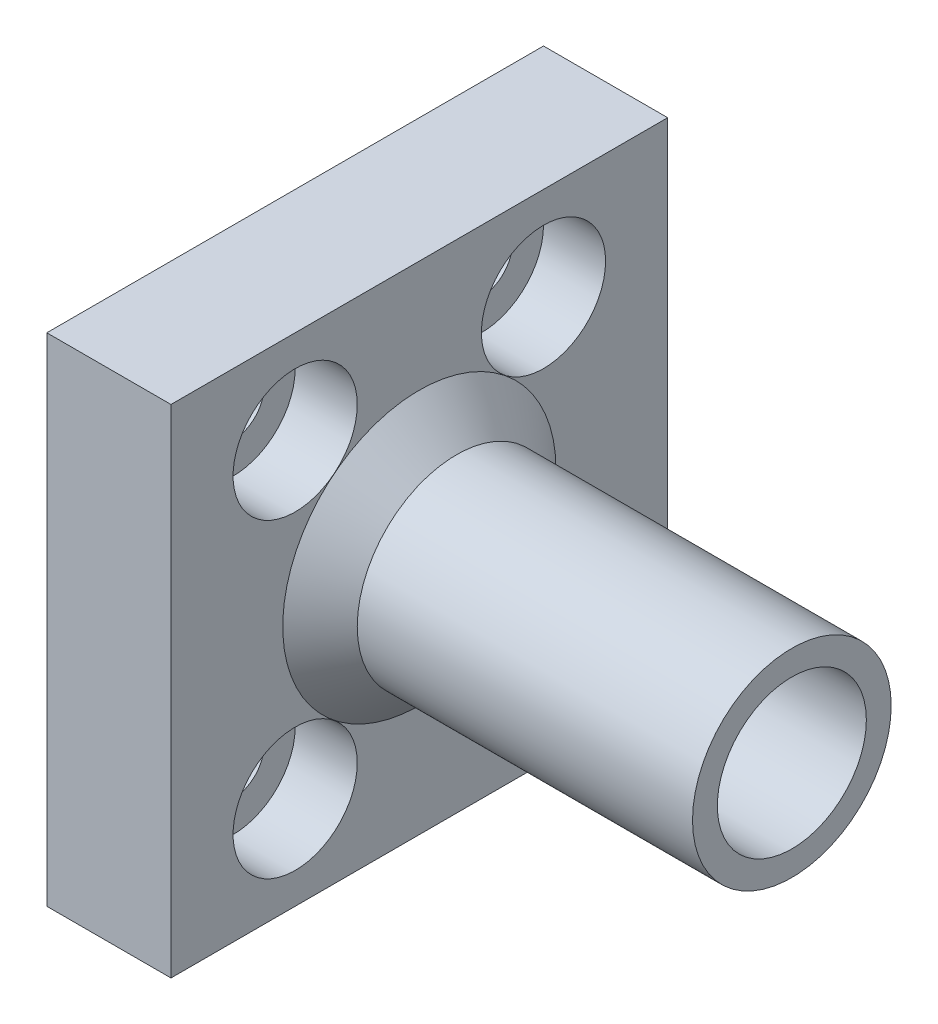
from build123d import *

# Parameters (mm, degrees)
SKETCH1_W           = 40
SKETCH1_H           = 40
BOSS_EXTRUDE1_DEPTH = 10
SKETCH2_R           = 8
BOSS_EXTRUDE2_DEPTH = 30
SKETCH4_R           = 2.5
CUT_EXTRUDE1_DEPTH  = 42.231056256
SKETCH5_R           = 6
CUT_EXTRUDE2_DEPTH  = 34
SKETCH6_R           = 5
CUT_EXTRUDE3_DEPTH  = 5
SKETCH7_R           = 1
CUT_EXTRUDE4_DEPTH  = 45.226688775
SKETCH8_R           = 2.5
CUT_EXTRUDE5_DEPTH  = 3
CHAMFER1_SIZE       = 3


with BuildPart() as part:
    # Sketch1 → Boss-Extrude1 (new body)
    with BuildSketch(Plane(origin=(0, 0, 0), x_dir=(0, 0, -1), z_dir=(1, 0, 0))):
        Rectangle(SKETCH1_W, SKETCH1_H)
    extrude(amount=BOSS_EXTRUDE1_DEPTH)

    # Sketch2 → Boss-Extrude2 (add)
    with BuildSketch(Plane(origin=(10, 0, 0), x_dir=(0, 0, -1), z_dir=(1, 0, 0))):
        Circle(SKETCH2_R)
    extrude(amount=BOSS_EXTRUDE2_DEPTH)

    # Sketch4 → Cut-Extrude1 (cut, through all)
    with BuildSketch(Plane(origin=(10, 0, 0), x_dir=(0, 0, -1), z_dir=(1, 0, 0))):
        with Locations((-10, 12.5)):
            Circle(SKETCH4_R)
        with Locations((-10, -12.5)):
            Circle(SKETCH4_R)
        with Locations((10, 12.5)):
            Circle(SKETCH4_R)
        with Locations((10, -12.5)):
            Circle(SKETCH4_R)
    extrude(amount=-CUT_EXTRUDE1_DEPTH, mode=Mode.SUBTRACT)

    # Sketch5 → Cut-Extrude2 (cut)
    with BuildSketch(Plane(origin=(40, 0, 0), x_dir=(0, 0, -1), z_dir=(1, 0, 0))):
        Circle(SKETCH5_R)
    extrude(amount=-CUT_EXTRUDE2_DEPTH, mode=Mode.SUBTRACT)

    # Sketch6 → Cut-Extrude3 (cut)
    with BuildSketch(Plane(origin=(10, 0, 0), x_dir=(0, 0, -1), z_dir=(1, 0, 0))):
        with Locations((-10, 12.5)):
            Circle(SKETCH6_R)
        with Locations((10, 12.5)):
            Circle(SKETCH6_R)
        with Locations((10, -12.5)):
            Circle(SKETCH6_R)
        with Locations((-10, -12.5)):
            Circle(SKETCH6_R)
    extrude(amount=-CUT_EXTRUDE3_DEPTH, mode=Mode.SUBTRACT)

    # Sketch7 → Cut-Extrude4 (cut, through all)
    with BuildSketch(Plane(origin=(6, 0, 0), x_dir=(0, 0, -1), z_dir=(1, 0, 0))):
        Circle(SKETCH7_R)
    extrude(amount=-CUT_EXTRUDE4_DEPTH, mode=Mode.SUBTRACT)

    # Sketch8 → Cut-Extrude5 (cut)
    with BuildSketch(Plane.ZY):
        Circle(SKETCH8_R)
    extrude(amount=-CUT_EXTRUDE5_DEPTH, mode=Mode.SUBTRACT)

    # Chamfer1
    chamfer1_edges = [part.edges().sort_by_distance(p)[0] for p in [
        (10, 0, 8),
    ]]
    chamfer(chamfer1_edges, length=CHAMFER1_SIZE)


solid = part.part
